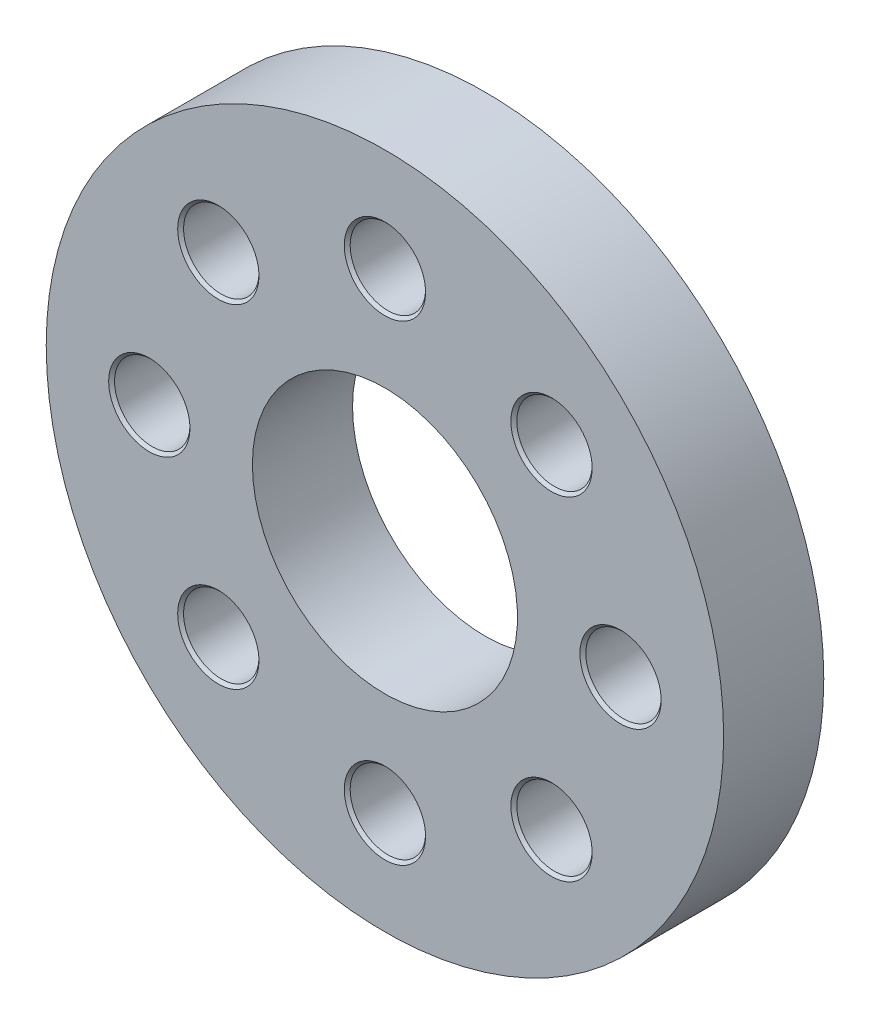
from build123d import *

# Parameters (mm, degrees)
SKETCH3_R                    = 57.5
SKETCH3_R_2                  = 22.5
BOSS_EXTRUDE2_DEPTH          = 17
SKETCH10_R                   = 6.4
CUT_EXTRUDE6_DEPTH           = 84.075267078
CHAMFER4_SIZE                = 0.5
CIRPATTERN3_COUNT            = 8
CHAMFER4_OF_CIRPATTERN3_SIZE = 0.5


with BuildPart() as part:
    # Sketch3 → Boss-Extrude2 (new body)
    with BuildSketch(Plane(origin=(0, 0, 0), x_dir=(-1, 0, 0), z_dir=(0, 0, -1))):
        Circle(SKETCH3_R)
        Circle(SKETCH3_R_2, mode=Mode.SUBTRACT)
    extrude(amount=BOSS_EXTRUDE2_DEPTH)

    # Sketch10 → Cut-Extrude6 (cut, through all)
    with BuildSketch(Plane.XY):
        with Locations((-40, 0)):
            Circle(SKETCH10_R)
    cut_extrude6 = extrude(amount=-CUT_EXTRUDE6_DEPTH, mode=Mode.SUBTRACT)

    # Chamfer4
    chamfer4_edges = [part.edges().sort_by_distance(p)[0] for p in [
        (-46.4, 0, 0),
        (-46.4, 0, -17),
    ]]
    chamfer(chamfer4_edges, length=CHAMFER4_SIZE)

    # CirPattern3: Cut-Extrude6 ×8 about axis
    cirpattern3_axis = Axis((0, 0, -17), (0, 0, 1))
    for i in range(1, CIRPATTERN3_COUNT):
        add(cut_extrude6.rotate(cirpattern3_axis, i * 360 / CIRPATTERN3_COUNT), mode=Mode.SUBTRACT)

    # Chamfer4 of CirPattern3
    chamfer4_of_cirpattern3_edges = [part.edges().sort_by_distance(p)[0] for p in [
        (-32.809754647, -32.809754647, 0),
        (-32.809754647, -32.809754647, -17),
        (0, -46.4, 0),
        (0, -46.4, -17),
        (32.809754647, -32.809754647, 0),
        (32.809754647, -32.809754647, -17),
        (46.4, 0, 0),
        (46.4, 0, -17),
        (32.809754647, 32.809754647, 0),
        (32.809754647, 32.809754647, -17),
        (0, 46.4, 0),
        (0, 46.4, -17),
        (-32.809754647, 32.809754647, 0),
        (-32.809754647, 32.809754647, -17),
    ]]
    chamfer(chamfer4_of_cirpattern3_edges, length=CHAMFER4_OF_CIRPATTERN3_SIZE)


solid = part.part
